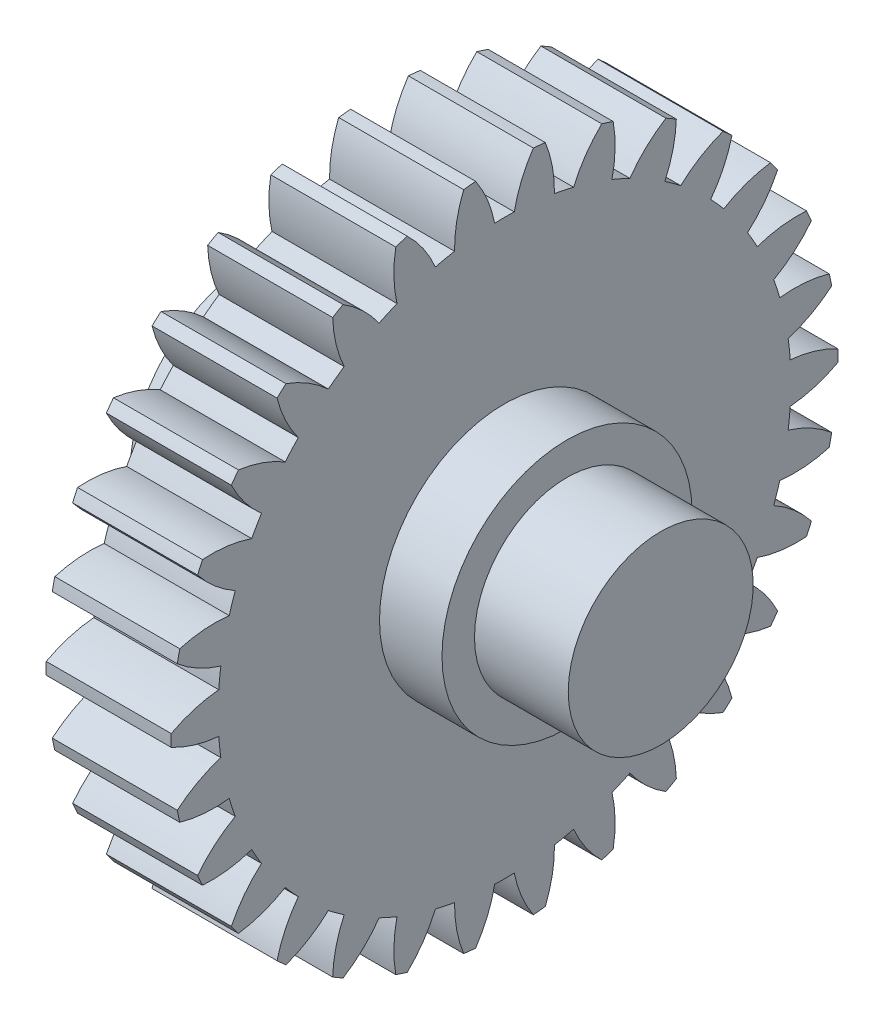
from build123d import *

# Parameters (mm, degrees)
BASPROSKE_W         = 12.7
BASPROSKE_H         = 33.866666667
TOOTHCUT_DEPTH      = 50.549896289
TEETHCUTS_COUNT     = 30
TEETHCUTS_ANGLE     = 348
SKETCH1_R           = 12.7
SKETCH1_R_2         = 5.08
BOSS_EXTRUDE2_DEPTH = 12.7
SKETCH3_R           = 3.302
CUT_EXTRUDE1_DEPTH  = 50.463042002
CUT_EXTRUDE2_DEPTH  = 8.255
BOSS_EXTRUDE3_START = 6.35
SKETCH5_R           = 12.7
BOSS_EXTRUDE3_DEPTH = 6.35
SKETCH6_R           = 9.398
BOSS_EXTRUDE4_DEPTH = 9.525


with BuildPart() as part:
    # BasProSke → Base-Revolve (revolve)
    with BuildSketch(Plane(origin=(0, 0, 0), x_dir=(1, 0, 0), z_dir=(0, 1, 0))):
        with Locations((6.35, 16.933333334)):
            Rectangle(BASPROSKE_W, BASPROSKE_H)
    revolve(axis=Axis((-10, 0, 0), (1, 0, 0)))

    # TooCutSke → ToothCut (cut, through all)
    with BuildSketch(Plane(origin=(0, 0, 0), x_dir=(0, 0, -1), z_dir=(1, 0, 0))):
        with BuildLine():
            ThreePointArc((0.995262134, 29.085873679), (0, 29.102896667), (-0.995262134, 29.085873679))
            ThreePointArc((-0.995262134, 29.085873679), (-1.736289099, 31.523168017), (-2.948832865, 33.763539028))
            ThreePointArc((-2.948832865, 33.763539028), (0, 33.892066667), (2.948832865, 33.763539028))
            ThreePointArc((2.948832865, 33.763539028), (1.736289099, 31.523168017), (0.995262134, 29.085873679))
        make_face()
    toothcut = extrude(amount=TOOTHCUT_DEPTH, mode=Mode.SUBTRACT)

    # TeethCuts: ToothCut ×30 about axis
    teethcuts_axis = Axis((-10, 0, 0), (1, 0, 0))
    for i in range(1, TEETHCUTS_COUNT):
        add(toothcut.rotate(teethcuts_axis, i * TEETHCUTS_ANGLE / (TEETHCUTS_COUNT - 1)), mode=Mode.SUBTRACT)

    # Sketch1 → Boss-Extrude2 (add)
    with BuildSketch(Plane.ZY):
        Circle(SKETCH1_R)
        Circle(SKETCH1_R_2, mode=Mode.SUBTRACT)
    extrude(amount=BOSS_EXTRUDE2_DEPTH)

    # Sketch3 → Cut-Extrude1 (cut, through all)
    with BuildSketch(Plane(origin=(0, 0, 0), x_dir=(1, 0, 0), z_dir=(0, 1, 0))):
        with Locations((-6.35, 0)):
            Circle(SKETCH3_R)
    extrude(amount=CUT_EXTRUDE1_DEPTH, mode=Mode.SUBTRACT)

    # Sketch4 → Cut-Extrude2 (cut)
    with BuildSketch(Plane(origin=(0, 0, 0), x_dir=(1, 0, 0), z_dir=(0, 1, 0))):
        Polygon((-3.527045859, 4.8895), (-9.172954141, 4.8895), (-11.995908282, 0), (-9.172954141, -4.8895), (-3.527045859, -4.8895), (-0.704091718, 0), align=None)
    extrude(amount=CUT_EXTRUDE2_DEPTH, mode=Mode.SUBTRACT)

    # Sketch5 → Boss-Extrude3 (add)
    with BuildSketch(Plane(origin=(12.7, 0, 0), x_dir=(0, 0, -1), z_dir=(1, 0, 0)).offset(BOSS_EXTRUDE3_START)):
        Circle(SKETCH5_R)
    extrude(amount=-BOSS_EXTRUDE3_DEPTH)

    # Sketch6 → Boss-Extrude4 (add)
    with BuildSketch(Plane(origin=(19.05, 0, 0), x_dir=(0, 0, -1), z_dir=(1, 0, 0))):
        Circle(SKETCH6_R)
    extrude(amount=BOSS_EXTRUDE4_DEPTH)


solid = part.part
